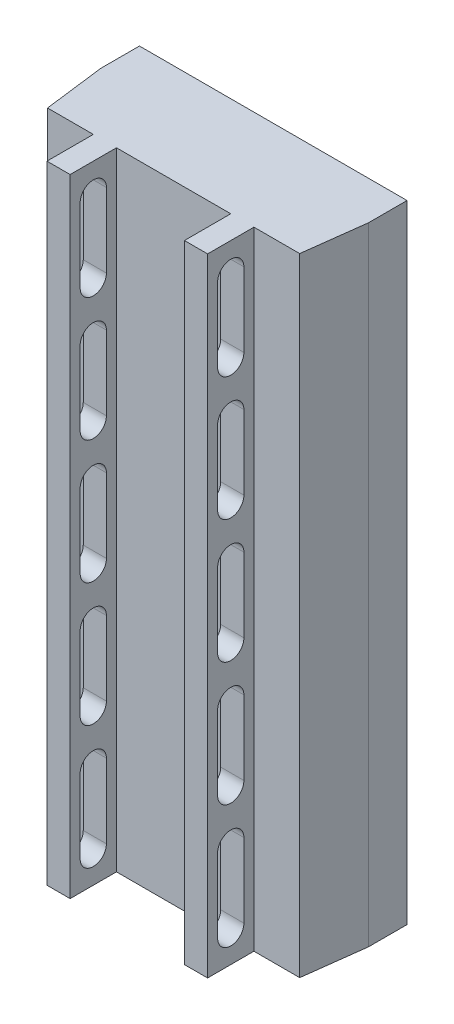
from build123d import *

# Parameters (mm, degrees)
BOSS_EXTRUDE1_DEPTH             = 80.2
BOSS_EXTRUDE2_DEPTH             = 1
SKETCH4_W                       = 3
SKETCH4_H                       = 81.2
BOSS_EXTRUDE3_DEPTH             = 6
M3_START                        = 5.925
M3_CLEARANCE_SLOT1_DEPTH        = 20.8
SKETCH24_W                      = 20.25
SKETCH24_H                      = 3
CUT_EXTRUDE5_DEPTH              = 1
BOSS_EXTRUDE7_DEPTH             = 7.8
SKETCH31_W                      = 34.65
SKETCH31_H                      = 3
CUT_EXTRUDE6_DEPTH              = 95
SKETCH34_W                      = 6.25
SKETCH34_H                      = 14.559328602
BOSS_EXTRUDE8_DEPTH             = 7.6
SKETCH35_R                      = 2.1
CUT_EXTRUDE7_DEPTH              = 4
SKETCH36_W                      = 19
SKETCH36_H                      = 35
BOSS_EXTRUDE9_DEPTH             = 0.8
TAP_DRILL_FOR_M3X0_5_TAP1_D     = 2.5
TAP_DRILL_FOR_M3X0_5_TAP1_DEPTH = 6.5
TAP_DRILL_FOR_M3X0_5_TAP1_TIP   = 0.751075774
TAP_DRILL_FOR_M3X0_5_TAP2_D     = 2.5
TAP_DRILL_FOR_M3X0_5_TAP2_DEPTH = 6.5
TAP_DRILL_FOR_M3X0_5_TAP2_TIP   = 0.751075774


# Read off the part's stored shape, not the designer's step: M3 Clearance Slot1
with BuildPart() as part:
    # Sketch1 → Boss-Extrude1 (new body)
    with BuildSketch(Plane(origin=(0, 0, 0), x_dir=(1, 0, 0), z_dir=(0, 1, 0))):
        Polygon((0, 0), (32.65, 0), (33.65, 7.9), (33.65, 15.9), (31.65, 15.9), (31.65, 1), (1, 1), (1, 15.9), (-1, 15.9), (-1, 7.9), align=None)
    extrude(amount=BOSS_EXTRUDE1_DEPTH)

    # Sketch2 → Boss-Extrude2 (add)
    with BuildSketch(Plane(origin=(0, 80.2, 0), x_dir=(1, 0, 0), z_dir=(0, 1, 0))):
        Polygon((32.65, 0), (0, 0), (-1, 7.9), (-1, 15.9), (33.65, 15.9), (33.65, 7.9), align=None)
    extrude(amount=BOSS_EXTRUDE2_DEPTH)

    # Sketch4 → Boss-Extrude3 (add)
    with BuildSketch(Plane.XY):
        with Locations((25.225, 40.6)):
            Rectangle(SKETCH4_W, SKETCH4_H)
        with Locations((7.425, 40.6)):
            Rectangle(SKETCH4_W, SKETCH4_H)
    extrude(amount=BOSS_EXTRUDE3_DEPTH)

    # M3 Clearance Slot1 outline → M3 Clearance Slot1 (cut)
    with BuildSketch(Plane.YZ.offset(M3_START)):
        with BuildLine():
            ThreePointArc((13.4, 1.3), (15.1, 3), (13.4, 4.7))
            Line((13.4, 4.7), (3.8, 4.7))
            ThreePointArc((3.8, 4.7), (2.1, 3), (3.8, 1.3))
            Line((3.8, 1.3), (13.4, 1.3))
        make_face()
        with BuildLine():
            ThreePointArc((19.8, 4.7), (18.1, 3), (19.8, 1.3))
            Line((19.8, 1.3), (29.4, 1.3))
            ThreePointArc((29.4, 1.3), (31.1, 3), (29.4, 4.7))
            Line((29.4, 4.7), (19.8, 4.7))
        make_face()
        with BuildLine():
            ThreePointArc((35.8, 4.7), (34.1, 3), (35.8, 1.3))
            Line((35.8, 1.3), (45.4, 1.3))
            ThreePointArc((45.4, 1.3), (47.1, 3), (45.4, 4.7))
            Line((45.4, 4.7), (35.8, 4.7))
        make_face()
        with BuildLine():
            ThreePointArc((51.8, 4.7), (50.1, 3), (51.8, 1.3))
            Line((51.8, 1.3), (61.4, 1.3))
            ThreePointArc((61.4, 1.3), (63.1, 3), (61.4, 4.7))
            Line((61.4, 4.7), (51.8, 4.7))
        make_face()
        with BuildLine():
            ThreePointArc((67.8, 4.7), (66.1, 3), (67.8, 1.3))
            Line((67.8, 1.3), (77.4, 1.3))
            ThreePointArc((77.4, 1.3), (79.1, 3), (77.4, 4.7))
            Line((77.4, 4.7), (67.8, 4.7))
        make_face()
    extrude(amount=M3_CLEARANCE_SLOT1_DEPTH, mode=Mode.SUBTRACT)

    # Sketch24 → Cut-Extrude5 (cut)
    with BuildSketch(Plane(origin=(0, 81.2, 0), x_dir=(1, 0, 0), z_dir=(0, 1, 0))):
        with Locations((16.325, 14.4)):
            Rectangle(SKETCH24_W, SKETCH24_H)
    extrude(amount=-CUT_EXTRUDE5_DEPTH, mode=Mode.SUBTRACT)

    # Sketch30 → Boss-Extrude7 (add)
    with BuildSketch(Plane(origin=(0, 0, -1), x_dir=(-1, 0, 0), z_dir=(0, 0, -1))):
        Polygon((-26.8, 27.95), (-19.425, 27.95), (-19.425, 28.95), (-25.8, 28.95), (-25.8, 63.95), (-6.8, 63.95), (-6.8, 28.95), (-13.175, 28.95), (-13.175, 27.95), (-5.8, 27.95), (-5.8, 64.95), (-26.8, 64.95), align=None)
        Polygon((-31.65, 80.2), (-31.65, 27.95), (-26.8, 27.95), (-26.8, 64.95), (-5.8, 64.95), (-5.8, 27.95), (-1, 27.95), (-1, 80.2), align=None)
        Polygon((-31.65, 27.95), (-31.65, 14.390671398), (-19.425, 14.390671398), (-19.425, 27.95), (-26.8, 27.95), align=None)
        Polygon((-13.175, 27.95), (-13.175, 14.390671398), (-1, 14.390671398), (-1, 27.95), (-5.8, 27.95), align=None)
    extrude(amount=BOSS_EXTRUDE7_DEPTH)

    # Sketch31 → Cut-Extrude6 (cut)
    with BuildSketch(Plane.XZ):
        with Locations((16.325, -14.4)):
            Rectangle(SKETCH31_W, SKETCH31_H)
    extrude(amount=-CUT_EXTRUDE6_DEPTH, mode=Mode.SUBTRACT)

    # Sketch34 → Boss-Extrude8 (add)
    with BuildSketch(Plane(origin=(0, 0, -1), x_dir=(-1, 0, 0), z_dir=(0, 0, -1))):
        with Locations((-16.3, 21.670335699)):
            Rectangle(SKETCH34_W, SKETCH34_H)
    extrude(amount=BOSS_EXTRUDE8_DEPTH)

    # Sketch35 → Cut-Extrude7 (cut)
    with BuildSketch(Plane(origin=(0, 0, -8.8), x_dir=(-1, 0, 0), z_dir=(0, 0, -1))):
        with Locations((-26.475, 70.1)):
            Circle(SKETCH35_R)
        with Locations((-6.175, 70.1)):
            Circle(SKETCH35_R)
        with Locations((-6.175, 17.95)):
            Circle(SKETCH35_R)
        with Locations((-26.475, 17.95)):
            Circle(SKETCH35_R)
    extrude(amount=-CUT_EXTRUDE7_DEPTH, mode=Mode.SUBTRACT)

    # Sketch36 → Boss-Extrude9 (add)
    with BuildSketch(Plane(origin=(0, 0, -1), x_dir=(-1, 0, 0), z_dir=(0, 0, -1))):
        with Locations((-16.3, 46.45)):
            Rectangle(SKETCH36_W, SKETCH36_H)
    extrude(amount=BOSS_EXTRUDE9_DEPTH)

    # Tap Drill for M3x0.5 Tap1
    with Locations(Plane(origin=(28.15, 76.7, -8.8), x_dir=(-1, 0, 0), z_dir=(0, 0, -1))):
        with Locations((0, 0), (23.65, 0)):
            Hole(TAP_DRILL_FOR_M3X0_5_TAP1_D / 2, depth=TAP_DRILL_FOR_M3X0_5_TAP1_DEPTH)
            with Locations((0, 0, -(TAP_DRILL_FOR_M3X0_5_TAP1_DEPTH + TAP_DRILL_FOR_M3X0_5_TAP1_TIP / 2))):  # 118° drill point
                Cone(0, TAP_DRILL_FOR_M3X0_5_TAP1_D / 2, TAP_DRILL_FOR_M3X0_5_TAP1_TIP, mode=Mode.SUBTRACT)

    # Tap Drill for M3x0.5 Tap2
    with Locations(Plane(origin=(25.725, 22.85, -8.8), x_dir=(-1, 0, 0), z_dir=(0, 0, -1))):
        with Locations((0, 0), (18.8, 0)):
            Hole(TAP_DRILL_FOR_M3X0_5_TAP2_D / 2, depth=TAP_DRILL_FOR_M3X0_5_TAP2_DEPTH)
            with Locations((0, 0, -(TAP_DRILL_FOR_M3X0_5_TAP2_DEPTH + TAP_DRILL_FOR_M3X0_5_TAP2_TIP / 2))):  # 118° drill point
                Cone(0, TAP_DRILL_FOR_M3X0_5_TAP2_D / 2, TAP_DRILL_FOR_M3X0_5_TAP2_TIP, mode=Mode.SUBTRACT)


solid = part.part
